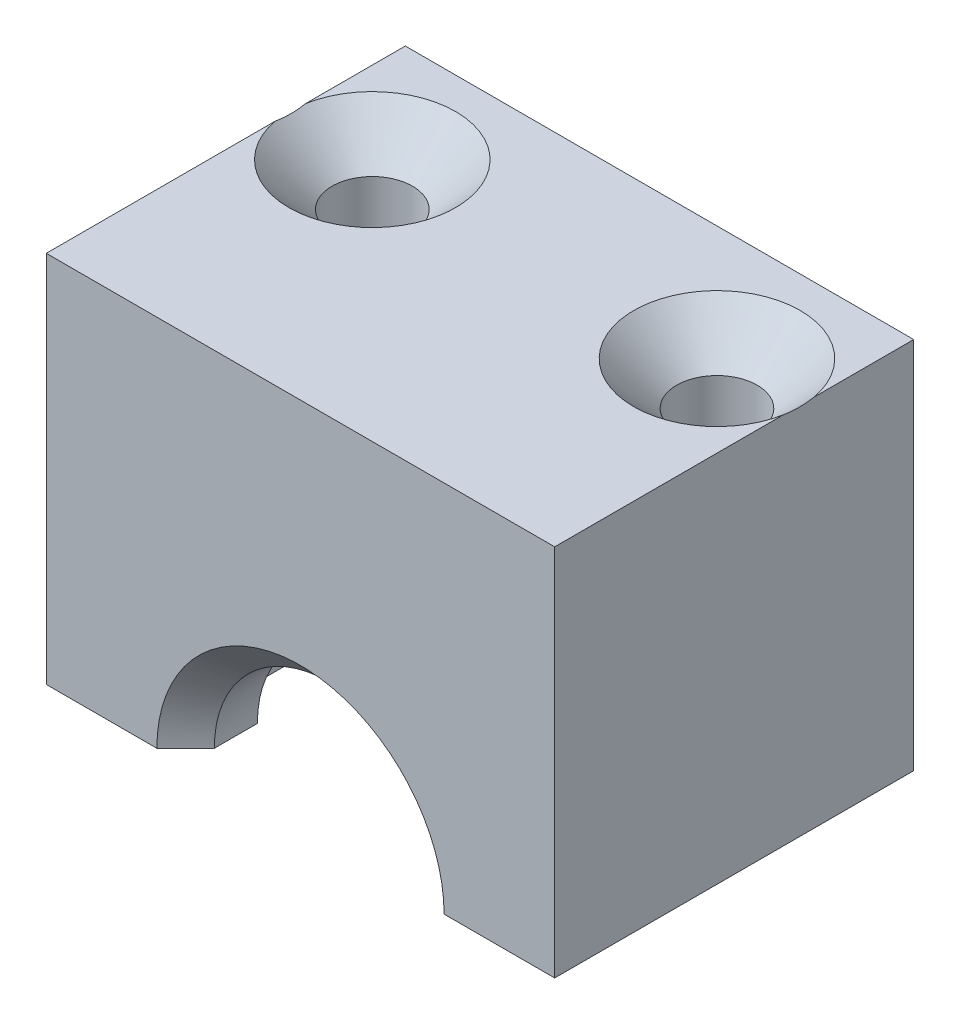
from build123d import *

# Parameters (mm, degrees)
SKETCH_2_W            = 17.7
SKETCH_2_H            = 13
EXTRUDE_380_DEPTH     = 6.25
SKETCH_3_R            = 4
CUT_EXTRUDE_527_DEPTH = 21.089113968
CUT_EXTRUDE_START     = -2.5
SKETCH_4_R            = 5.25
CUT_EXTRUDE_676_DEPTH = 4.5
SKETCH_5_R            = 1.4
CUT_EXTRUDE_872_DEPTH = 17.922913461
CHAMFER_2_SIZE        = 1
CHAMFER_3_SIZE        = 1.5


with BuildPart() as part:
    # Эскиз2 → Extrude 380 (new, symmetric)
    with BuildSketch(Plane.XY):
        with Locations((0, 6.5)):
            Rectangle(SKETCH_2_W, SKETCH_2_H)
    extrude(amount=EXTRUDE_380_DEPTH, both=True)

    # Эскиз3 → Cut-Extrude 527 (cut, through all)
    with BuildSketch(Plane.XY.offset(6.25)):
        Circle(SKETCH_3_R)
    extrude(amount=-CUT_EXTRUDE_527_DEPTH, mode=Mode.SUBTRACT)

    # Эскиз4 → Cut-Extrude 676 (cut)
    with BuildSketch(Plane.XY.offset(6.25).offset(CUT_EXTRUDE_START)):
        Circle(SKETCH_4_R)
    extrude(amount=-CUT_EXTRUDE_676_DEPTH, mode=Mode.SUBTRACT)

    # Эскиз5 → Cut-Extrude 872 (cut, through all)
    with BuildSketch(Plane(origin=(0, 13, 0), x_dir=(1, 0, 0), z_dir=(0, 1, 0))):
        with Locations(Location((-6, 2.25, 0), (0, 0, 270))):
            Circle(SKETCH_5_R)
        with Locations(Location((6, 2.25, 0), (0, 0, 270))):
            Circle(SKETCH_5_R)
    extrude(amount=-CUT_EXTRUDE_872_DEPTH, mode=Mode.SUBTRACT)

    # Фаска2
    chamfer_2_edges = [part.edges().sort_by_distance(p)[0] for p in [
        (0, 4, 6.25),
        (0, 4, -6.25),
    ]]
    chamfer(chamfer_2_edges, length=CHAMFER_2_SIZE)

    # Фаска3
    # the kernel refuses this chamfer: 1.5 mm, written as the material it takes off along each edge
    with BuildSketch(Plane(origin=(-6, 13, -2.25), x_dir=(0, 0, 1), z_dir=(-1, 0, 0))) as chamfer_3_piece_1:
        Polygon((1.4 + CHAMFER_3_SIZE, 0), (1.4, -CHAMFER_3_SIZE), (1.4, 0), align=None)
    revolve(axis=Axis((-6, 13, -2.25), (0, 1, 0)), mode=Mode.SUBTRACT)
    with BuildSketch(Plane(origin=(6, 13, -2.25), x_dir=(0, 0, 1), z_dir=(-1, 0, 0))) as chamfer_3_piece_2:
        Polygon((1.4, -CHAMFER_3_SIZE), (1.4 + CHAMFER_3_SIZE, 0), (1.4, 0), align=None)
    revolve(axis=Axis((6, 13, -2.25), (0, 1, 0)), mode=Mode.SUBTRACT)


solid = part.part
